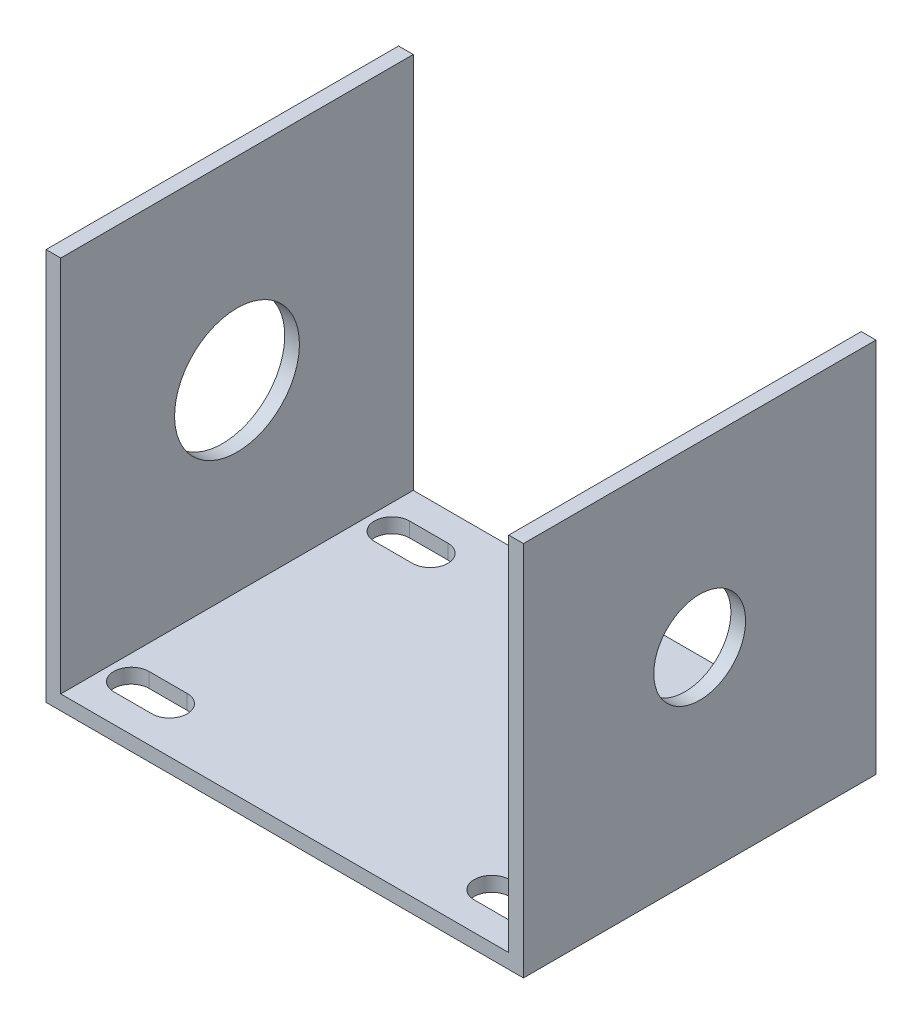
from build123d import *

# Parameters (mm, degrees)
BOSS_EXTRUDE1_DEPTH     = 12
CUT_EXTRUDE1_DEPTH      = 44.43604494
CUT_EXTRUDE1_DEPTH_BACK = 44.43604494
SKETCH2_R               = 3.125
CUT_EXTRUDE2_DEPTH      = 44.43604494
CUT_EXTRUDE2_DEPTH_BACK = 24
SKETCH3_R               = 4.25
CUT_EXTRUDE3_DEPTH      = 24


with BuildPart() as part:
    # Sketch1 → Boss-Extrude1 (new, symmetric)
    with BuildSketch(Plane.XY):
        Polygon((16.25, -0.5), (16.25, 25.113793103), (15.25, 25.113793103), (15.25, 0.5), (-15.25, 0.5), (-15.25, 26.2), (-16.25, 26.2), (-16.25, -0.5), align=None)
    extrude(amount=BOSS_EXTRUDE1_DEPTH, both=True)

    # Sketch2 → Cut-Extrude1 (cut, two sides: drawn at the far end of the back side and taken through both)
    with BuildSketch(Plane(origin=(16.25, 0, 0), x_dir=(0, 0, -1), z_dir=(1, 0, 0)).offset(-CUT_EXTRUDE1_DEPTH_BACK)):
        with Locations((0, 13)):
            Circle(SKETCH2_R)
    extrude(amount=CUT_EXTRUDE1_DEPTH + CUT_EXTRUDE1_DEPTH_BACK, mode=Mode.SUBTRACT)

    # Sketch3 → Cut-Extrude2 (cut, two sides: drawn at the far end of the back side and taken through both)
    with BuildSketch(Plane.ZY.offset(16.25).offset(-CUT_EXTRUDE2_DEPTH_BACK)):
        with Locations((0, 13)):
            Circle(SKETCH3_R)
    extrude(amount=CUT_EXTRUDE2_DEPTH + CUT_EXTRUDE2_DEPTH_BACK, mode=Mode.SUBTRACT)

    # Sketch4 → Cut-Extrude3 (cut)
    with BuildSketch(Plane.XZ.offset(0.5)):
        with BuildLine():
            Line((-10.97, 10.07), (-13.57, 10.07))
            ThreePointArc((-13.57, 10.07), (-14.77, 8.87), (-13.57, 7.67))
            Line((-13.57, 7.67), (-10.97, 7.67))
            ThreePointArc((-10.97, 7.67), (-9.77, 8.87), (-10.97, 10.07))
        make_face()
        with BuildLine():
            Line((13.57, 10.07), (10.97, 10.07))
            ThreePointArc((10.97, 10.07), (9.77, 8.87), (10.97, 7.67))
            Line((10.97, 7.67), (13.57, 7.67))
            ThreePointArc((13.57, 7.67), (14.77, 8.87), (13.57, 10.07))
        make_face()
        with BuildLine():
            Line((10.97, -10.07), (13.57, -10.07))
            ThreePointArc((13.57, -10.07), (14.77, -8.87), (13.57, -7.67))
            Line((13.57, -7.67), (10.97, -7.67))
            ThreePointArc((10.97, -7.67), (9.77, -8.87), (10.97, -10.07))
        make_face()
        with BuildLine():
            Line((-13.57, -10.07), (-10.97, -10.07))
            ThreePointArc((-10.97, -10.07), (-9.77, -8.87), (-10.97, -7.67))
            Line((-10.97, -7.67), (-13.57, -7.67))
            ThreePointArc((-13.57, -7.67), (-14.77, -8.87), (-13.57, -10.07))
        make_face()
    extrude(amount=-CUT_EXTRUDE3_DEPTH, mode=Mode.SUBTRACT)


solid = part.part
